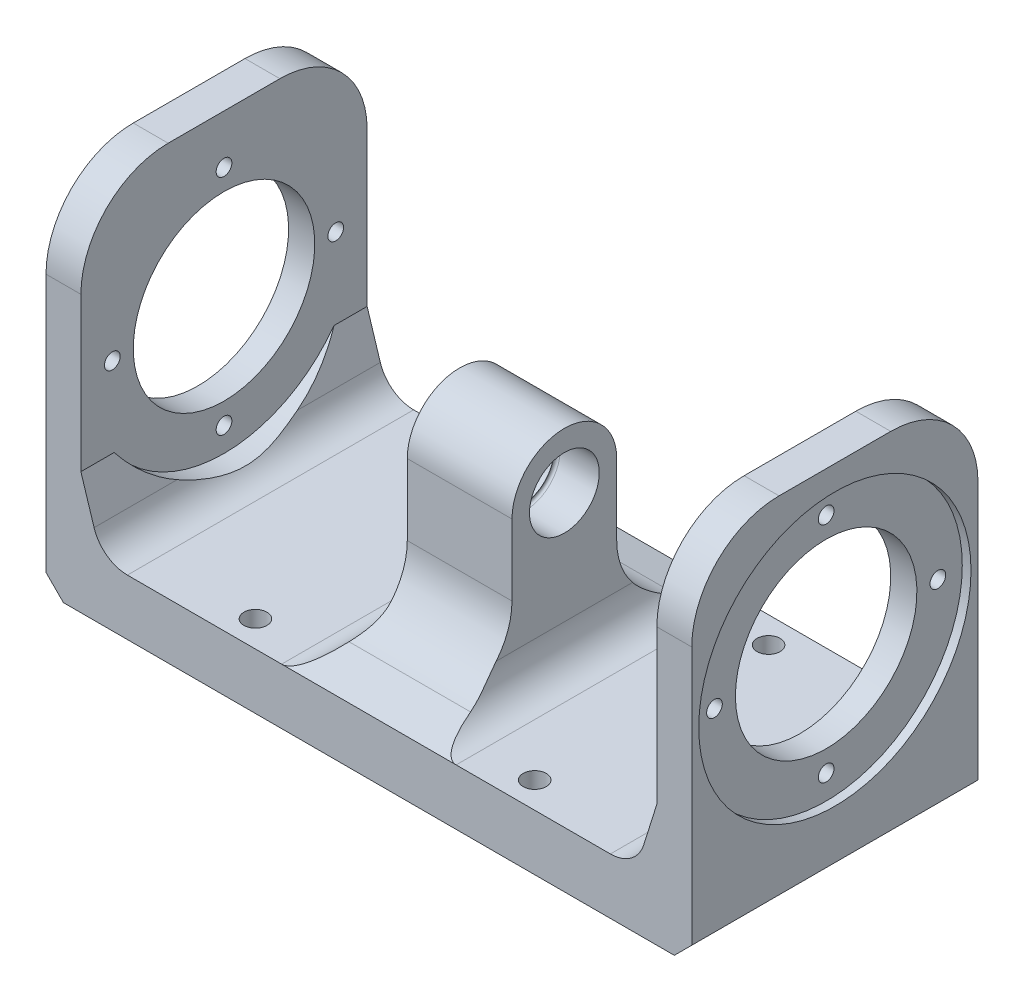
from build123d import *

# Parameters (mm, degrees)
BOSS_EXTRUDE1_DEPTH      = 82
SKETCH5_R                = 10
CUT_EXTRUDE1_DEPTH       = 12
CUT_EXTRUDE2_REACH       = 161.844
SKETCH6_R                = 9
CUT_EXTRUDE4_REACH       = 158.033
SKETCH8_R                = 26
CUT_EXTRUDE5_REACH       = 163.543
FILLET3_R                = 25
SKETCH13_R               = 39
CUT_EXTRUDE6_DEPTH       = 2.5
M4_CLEARANCE_HOLE1_D     = 4.5
M4_CLEARANCE_HOLE1_DEPTH = 7.5
FILLET5_R                = 0.8
CHAMFER1_SIZE            = 5
CHAMFER2_SIZE            = 5
BOSS_EXTRUDE3_START      = -82
BOSS_EXTRUDE3_DEPTH      = 82
SKETCH19_R               = 39
CUT_EXTRUDE7_DEPTH       = 20
M6_CLEARANCE_HOLE1_D     = 6.6
FILLET6_START            = -82.0000001
FILLET6_DEPTH            = 82.0000001
FILLET6_START_2          = -26
FILLET6_2_DEPTH          = 52


with BuildPart() as part:
    # Sketch1 → Boss-Extrude1 (new body)
    with BuildSketch(Plane.XY):
        Polygon((0, 0), (-82.5, 0), (-92.5, 0), (-92.5, 104), (-82.5, 104), (-82.5, 10), (-15, 10), (-15, 74), (0, 74), align=None)
    extrude(amount=-BOSS_EXTRUDE1_DEPTH)

    # Sketch5 → Cut-Extrude1 (cut)
    with BuildSketch(Plane.ZY.offset(15)):
        with Locations(Location((-41, 58, 0), (0, 0, 270))):
            Circle(SKETCH5_R)
    extrude(amount=-CUT_EXTRUDE1_DEPTH, mode=Mode.SUBTRACT)

    # Sketch6 → Cut-Extrude2 (cut, up to next)
    with BuildSketch(Plane.ZY.offset(3), mode=Mode.PRIVATE) as cut_extrude2_sk1:
        with Locations(Location((-41, 58, 0), (0, 0, 270))):
            Circle(SKETCH6_R)
    cut_extrude2_tool1 = extrude(cut_extrude2_sk1.sketch, amount=-CUT_EXTRUDE2_REACH, mode=Mode.PRIVATE) & part.part
    add(cut_extrude2_tool1.solids().sort_by_distance((-3, 58, -41))[0], mode=Mode.SUBTRACT)

    # Sketch8 → Cut-Extrude4 (cut, up to next)
    with BuildSketch(Plane(origin=(-82.5, 0, 0), x_dir=(0, 0, -1), z_dir=(1, 0, 0)), mode=Mode.PRIVATE) as cut_extrude4_sk1:
        with Locations(Location((41, 58, 0), (0, 0, 90))):
            Circle(SKETCH8_R)
    cut_extrude4_tool1 = extrude(cut_extrude4_sk1.sketch, amount=-CUT_EXTRUDE4_REACH, mode=Mode.PRIVATE) & part.part
    add(cut_extrude4_tool1.solids().sort_by_distance((-82.5, 58, -41))[0], mode=Mode.SUBTRACT)

    # Sketch10 → Cut-Extrude5 (cut, up to next)
    with BuildSketch(Plane(origin=(0, 0, 0), x_dir=(0, 0, -1), z_dir=(1, 0, 0)), mode=Mode.PRIVATE) as cut_extrude5_sk1:
        with BuildLine():
            Line((0, 74), (0, 16))
            Line((0, 16), (11.714285714, 19.492525222))
            ThreePointArc((11.714285714, 19.492525222), (22.035674515, 26.706536079), (26, 38.658822172))
            Line((26, 38.658822172), (26, 59))
            ThreePointArc((26, 59), (30.393398282, 69.606601718), (41, 74))
            Line((41, 74), (0, 74))
        make_face()
    cut_extrude5_tool1 = extrude(cut_extrude5_sk1.sketch, amount=-CUT_EXTRUDE5_REACH, mode=Mode.PRIVATE) & part.part
    # Sketch10 → Cut-Extrude5 (cut, up to next)
    with BuildSketch(Plane(origin=(0, 0, 0), x_dir=(0, 0, -1), z_dir=(1, 0, 0)), mode=Mode.PRIVATE) as cut_extrude5_sk2:
        with BuildLine():
            Line((82, 74), (41, 74))
            ThreePointArc((41, 74), (51.606601718, 69.606601718), (56, 59))
            Line((56, 59), (56, 38.658822172))
            ThreePointArc((56, 38.658822172), (59.964325485, 26.706536079), (70.285714286, 19.492525222))
            Line((70.285714286, 19.492525222), (82, 16))
            Line((82, 16), (82, 74))
        make_face()
    cut_extrude5_tool2 = extrude(cut_extrude5_sk2.sketch, amount=-CUT_EXTRUDE5_REACH, mode=Mode.PRIVATE) & part.part
    add(cut_extrude5_tool1.solids().sort_by_distance((0, 48.321716, -12.955067))[0], mode=Mode.SUBTRACT)
    add(cut_extrude5_tool2.solids().sort_by_distance((0, 48.321716, -69.044933))[0], mode=Mode.SUBTRACT)

    # Fillet3
    fillet3_edges = [part.edges().sort_by_distance(p)[0] for p in [
        (-87.5, 104, 0),
        (-87.5, 104, -82),
    ]]
    fillet(fillet3_edges, radius=FILLET3_R)

    # Sketch13 → Cut-Extrude6 (cut)
    with BuildSketch(Plane.ZY.offset(92.5)):
        with Locations((-41, 58)):
            Circle(SKETCH13_R)
    extrude(amount=-CUT_EXTRUDE6_DEPTH, mode=Mode.SUBTRACT)

    # M4 Clearance Hole1
    with Locations(Plane.ZY.offset(90)):
        with Locations((-41, 90), (-9, 58), (-41, 26), (-73, 58)):
            Hole(M4_CLEARANCE_HOLE1_D / 2, depth=M4_CLEARANCE_HOLE1_DEPTH)

    # Fillet5
    fillet5_edges = [part.edges().sort_by_distance(p)[0] for p in [
        (-3, 68, -41),
    ]]
    fillet(fillet5_edges, radius=FILLET5_R)

    # Mirror1: part across plane


with BuildPart() as part_1:
    add(part.part)
    add(part.part.mirror(Plane(origin=(0, 74, -82), x_dir=(0, 0, 1), z_dir=(1, 0, 0))))

    # Chamfer1
    chamfer1_edges = [part_1.edges().sort_by_distance(p)[0] for p in [
        (92.5, 0, -41),
        (-92.5, 0, -41),
    ]]
    chamfer(chamfer1_edges, length=CHAMFER1_SIZE)

    # Chamfer2
    chamfer2_edges = [part_1.edges().sort_by_distance(p)[0] for p in [
        (82.5, 10, -41),
        (-82.5, 10, -41),
    ]]
    chamfer(chamfer2_edges, length=CHAMFER2_SIZE)

    # Sketch18 → Boss-Extrude3 (add)
    with BuildSketch(Plane.XY.offset(BOSS_EXTRUDE3_START)):
        with BuildLine():
            Line((-82.5, 35), (-78.726174588, 23))
            ThreePointArc((-78.726174588, 23), (-75.102862357, 17.937742252), (-69.186782574, 16))
            Line((-69.186782574, 16), (0, 16))
            Line((0, 16), (0, 10))
            Line((0, 10), (-77.5, 10))
            Line((-77.5, 10), (-82.5, 15))
            Line((-82.5, 15), (-82.5, 35))
        make_face()
    boss_extrude3 = extrude(amount=BOSS_EXTRUDE3_DEPTH)

    # Mirror2: Boss-Extrude3 across plane
    add(boss_extrude3.mirror(Plane(origin=(0, 0, 0), x_dir=(0, 0, 1), z_dir=(1, 0, 0))))

    # Sketch19 → Cut-Extrude7 (cut)
    with BuildSketch(Plane(origin=(-82.5, 0, 0), x_dir=(0, 0, -1), z_dir=(1, 0, 0))):
        with Locations(Location((41, 58, 0), (0, 0, 180))):
            Circle(SKETCH19_R)
    cut_extrude7 = extrude(amount=CUT_EXTRUDE7_DEPTH, mode=Mode.SUBTRACT)

    # Mirror3: Cut-Extrude7 across plane
    add(cut_extrude7.mirror(Plane(origin=(0, 0, 0), x_dir=(0, 0, 1), z_dir=(1, 0, 0))), mode=Mode.SUBTRACT)

    # M6 Clearance Hole1 (through all)
    with Locations(Plane(origin=(0, 0, 0), x_dir=(-1, 0, 0), z_dir=(0, -1, 0))):
        with Locations((-40, 74.5), (40, 74.5), (40, 7.5), (-40, 7.5)):
            Hole(M6_CLEARANCE_HOLE1_D / 2)

    # Fillet6: read off the stored shape, not the designer's step
    # Fillet6 outline → Fillet6 (add)
    with BuildSketch(Plane.XY.offset(FILLET6_START)):
        with BuildLine():
            Line((15, 16), (25, 16))
            ThreePointArc((25, 16), (17.928932188, 18.928932188), (15, 26))
            Line((15, 26), (15, 16))
        make_face()
        with BuildLine():
            ThreePointArc((-15, 26), (-17.928932188, 18.928932188), (-25, 16))
            Line((-25, 16), (-15, 16))
            Line((-15, 16), (-15, 26))
        make_face()
    extrude(amount=FILLET6_DEPTH)

    # Fillet6 2 outline → Fillet6 2 (cut)
    with BuildSketch(Plane.YZ.offset(FILLET6_START_2)):
        with BuildLine():
            Line((19.492525222, -70.285714286), (16, -82))
            Line((16, -82), (26, -82.0000001))
            Line((26, -82.0000001), (26, -60.516001123))
            ThreePointArc((26, -60.516001123), (22.013361061, -64.912681821), (19.492525222, -70.285714286))
        make_face()
        with BuildLine():
            Line((26, 0), (16, 0))
            Line((16, 0), (19.492525222, -11.714285714))
            ThreePointArc((19.492525222, -11.714285714), (22.013361061, -17.087318179), (26, -21.483998877))
            Line((26, -21.483998877), (26, 0))
        make_face()
    extrude(amount=FILLET6_2_DEPTH, mode=Mode.SUBTRACT)


solid = part_1.part
